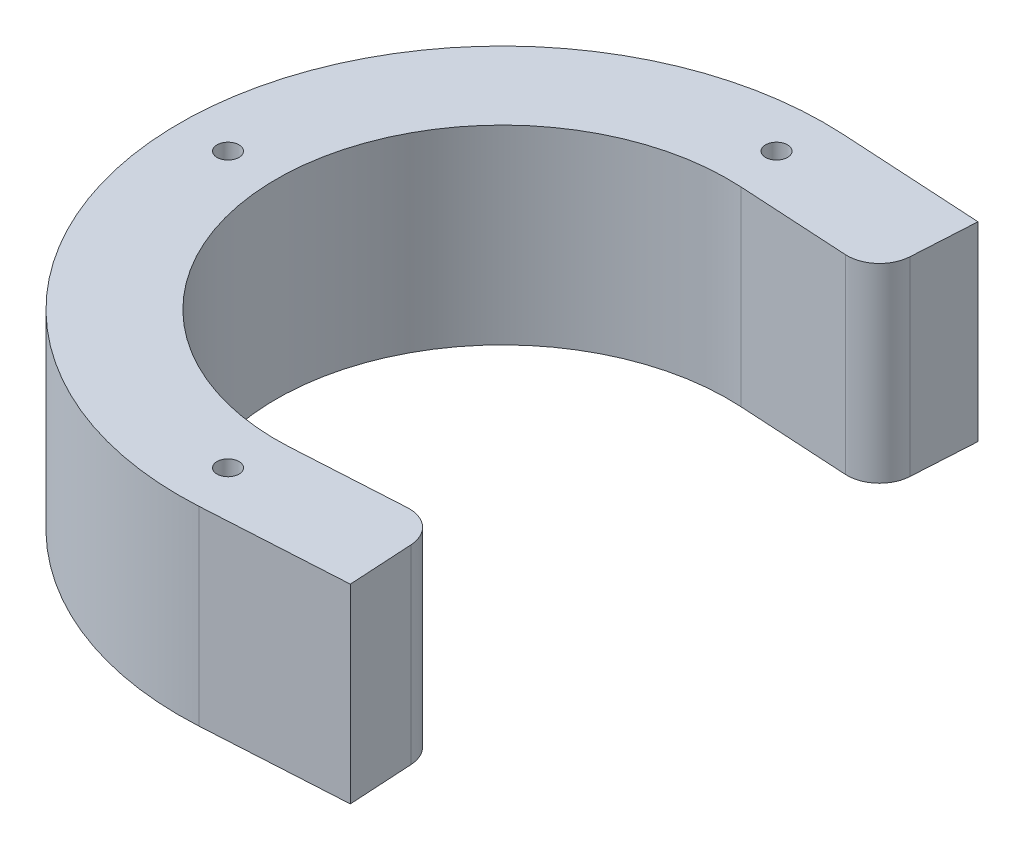
from build123d import *

# Parameters (mm, degrees)
SKETCH2_R           = 1.7
BOSS_EXTRUDE1_DEPTH = 29.5
FILLET2_R           = 5


with BuildPart() as part:
    # Sketch2 → Boss-Extrude1 (new body)
    with BuildSketch(Plane(origin=(0, 0, 0), x_dir=(1, 0, 0), z_dir=(0, 1, 0))):
        with BuildLine():
            Line((2.88691348, 49.91658773), (25.08691348, 48.632656232))
            Line((25.08691348, 48.632656232), (24.220839436, 33.657679913))
            Line((24.220839436, 33.657679913), (2.020839436, 34.941611411))
            ThreePointArc((2.020839436, 34.941611411), (-35, 0), (2.020839436, -34.941611411))
            Line((2.020839436, -34.941611411), (24.220839436, -33.657679913))
            Line((24.220839436, -33.657679913), (25.08691348, -48.632656232))
            Line((25.08691348, -48.632656232), (2.88691348, -49.91658773))
            ThreePointArc((2.88691348, -49.91658773), (-50, 0), (2.88691348, 49.91658773))
        make_face()
        with Locations((-42.5, 0)):
            Circle(SKETCH2_R, mode=Mode.SUBTRACT)
        with Locations((0, 42.5)):
            Circle(SKETCH2_R, mode=Mode.SUBTRACT)
        with Locations((0, -42.5)):
            Circle(SKETCH2_R, mode=Mode.SUBTRACT)
    extrude(amount=BOSS_EXTRUDE1_DEPTH)

    # Fillet2
    fillet2_edges = [part.edges().sort_by_distance(p)[0] for p in [
        (24.220839436, 14.75, 33.657679913),
        (24.220839436, 14.75, -33.657679913),
    ]]
    fillet(fillet2_edges, radius=FILLET2_R)


solid = part.part
